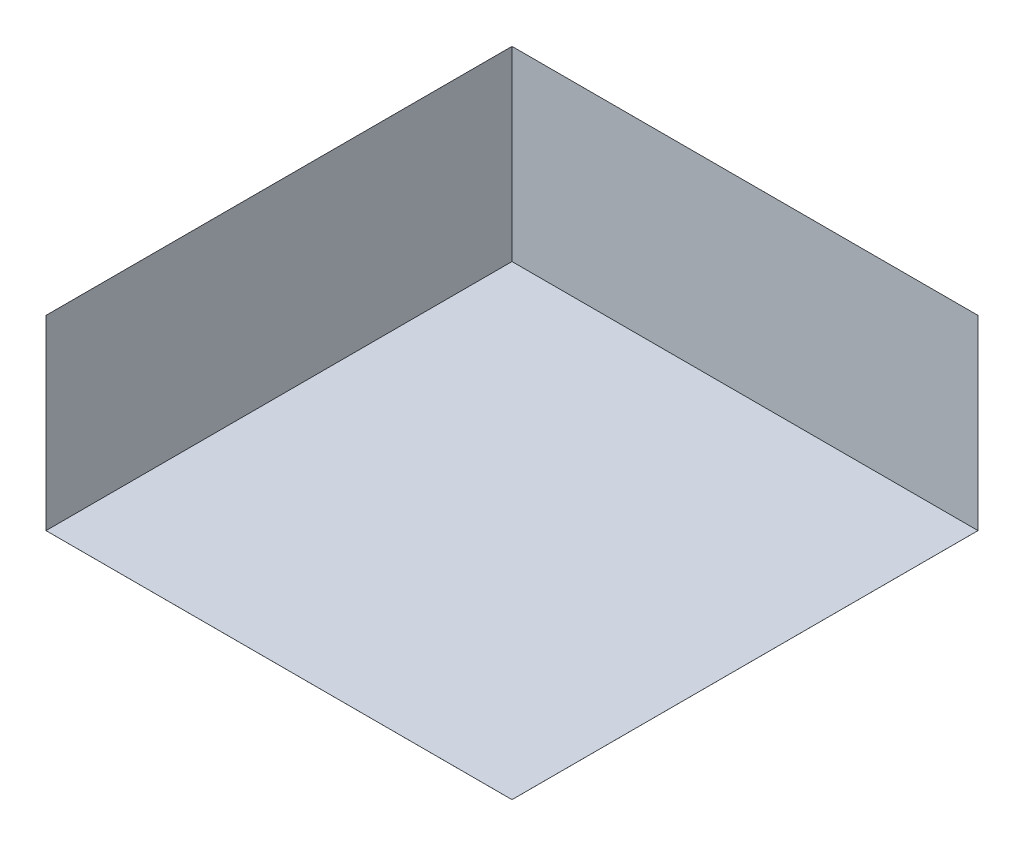
from build123d import *

# Parameters (mm, degrees)
SKETCH2_W     = 5000
SKETCH2_H     = 5000
FLOOR_2_DEPTH = 0.254
SKETCH3_W     = 5000
SKETCH3_H     = 0.0254
WALL1_DEPTH   = 2000
SKETCH4_W     = 0.0254
SKETCH4_H     = 5000
WALL2_DEPTH   = 2000


with BuildPart() as part:
    # Sketch2 → Floor 2 (new body)
    with BuildSketch(Plane(origin=(0, 0, 0), x_dir=(1, 0, 0), z_dir=(0, 1, 0))):
        with Locations((2446.679895561, -2480.502349869)):
            Rectangle(SKETCH2_W, SKETCH2_H)
    extrude(amount=FLOOR_2_DEPTH)


with BuildPart() as body_2:
    # Sketch3 → Wall1 (new body)
    with BuildSketch(Plane(origin=(0, 0.254, 0), x_dir=(1, 0, 0), z_dir=(0, 1, 0))):
        with Locations((2446.679895561, 19.510350131)):
            Rectangle(SKETCH3_W, SKETCH3_H)
    extrude(amount=WALL1_DEPTH)


with BuildPart() as body_3:
    # Sketch4 → Wall2 (new body)
    with BuildSketch(Plane(origin=(0, 0.254, 0), x_dir=(1, 0, 0), z_dir=(0, 1, 0))):
        with Locations((-53.332804439, -2480.502349869)):
            Rectangle(SKETCH4_W, SKETCH4_H)
    extrude(amount=WALL2_DEPTH)


solid = Compound([part.part, body_2.part, body_3.part])
